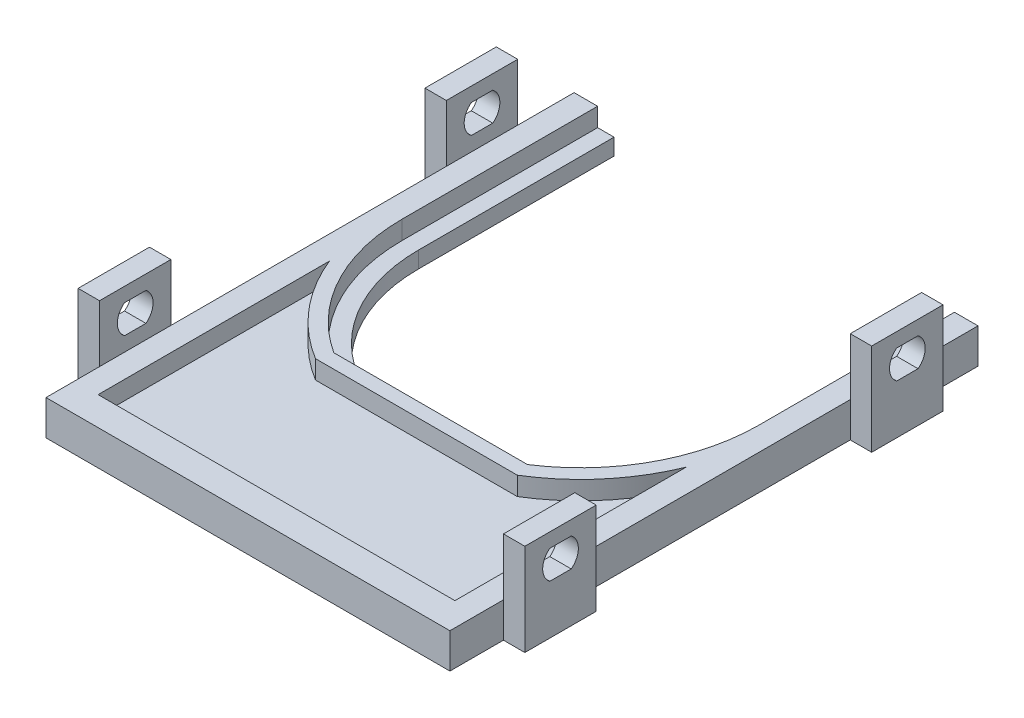
from build123d import *

# Parameters (mm, degrees)
STOCK_BATTERY_START                           = -4.6
STOCK_BATTERY_AND_MICRO_COMPARTMENT_1_DEPTH   = 4.6
STOCK_BATTERY_AND_MICRO_COMPARTMENT_1_2_DEPTH = 2.3
BOSS_EXTRUDE1_START                           = -4.6
BOSS_EXTRUDE1_DEPTH                           = 4.6
CUT_EXTRUDE1_DEPTH                            = 2.3
BOSS_EXTRUDE2_DEPTH                           = 0.3
SKETCH4_W                                     = 74
SKETCH4_H                                     = 4.9
BOSS_EXTRUDE3_DEPTH                           = 0.3
BOSS_EXTRUDE4_START                           = -56.3
SKETCH4_2_W                                   = 74
SKETCH4_2_H                                   = 4.9
BOSS_EXTRUDE4_DEPTH                           = 0.3
SKETCH5_W                                     = 10
SKETCH5_H                                     = 12.9
BOSS_EXTRUDE5_DEPTH                           = 3
BOSS_EXTRUDE7_START                           = -56.6
SKETCH5_2_W                                   = 10
SKETCH5_2_H                                   = 12.9
BOSS_EXTRUDE7_DEPTH                           = 3
CUT_EXTRUDE2_DEPTH                            = 81
CUT_EXTRUDE2_DEPTH_BACK                       = 10
CUT_EXTRUDE3_DEPTH                            = 128
CUT_EXTRUDE3_DEPTH_BACK                       = 10
BOSS_EXTRUDE8_REACH                           = 51.27
BOSS_EXTRUDE8_DIRECTION_2_DEPTH               = 0.03
BOSS_EXTRUDE9_DEPTH                           = 2
SPLIT1_START                                  = 0.33
SPLIT1_DEPTH                                  = 2
SPLIT1_START_2                                = -2.3
SPLIT1_2_DEPTH                                = 2.63


# Read off the part's stored shape, not the designer's step: Stock-Battery and Micro compartment-1, Split1
with BuildPart() as part:
    # Stock-Battery and Micro compartment-1 ou → Stock-Battery and Micro compartment-1 (new body)
    with BuildSketch(Plane(origin=(0, 0, 0), x_dir=(1, 0, 0), z_dir=(0, 1, 0)).offset(STOCK_BATTERY_START)):
        with BuildLine():
            Line((-28, 37.2), (-28, -36.8))
            Line((-28, -36.8), (28, -36.8))
            Line((28, -36.8), (28, 37.2))
            Line((28, 37.2), (25, 37.2))
            Line((25, 37.2), (25, 9.8))
            ThreePointArc((25, 9.8), (0, -15.2), (-25, 9.8))
            Line((-25, 9.8), (-25, 37.2))
            Line((-25, 37.2), (-28, 37.2))
        make_face()
    extrude(amount=STOCK_BATTERY_AND_MICRO_COMPARTMENT_1_DEPTH)

    # Stock-Battery and Micro compartment- 2 → Stock-Battery and Micro compartment-1 2 (add)
    with BuildSketch(Plane(origin=(0, 0, 0), x_dir=(1, 0, 0), z_dir=(0, 1, 0)).offset(STOCK_BATTERY_START)):
        with BuildLine():
            Line((-22.7, 37.2), (-25, 37.2))
            Line((-25, 37.2), (-25, 9.8))
            ThreePointArc((-25, 9.8), (0, -15.2), (25, 9.8))
            Line((25, 9.8), (25, 37.2))
            Line((25, 37.2), (22.7, 37.2))
            Line((22.7, 37.2), (22.7, 9.8))
            ThreePointArc((22.7, 9.8), (0, -12.9), (-22.7, 9.8))
            Line((-22.7, 9.8), (-22.7, 37.2))
        make_face()
    extrude(amount=STOCK_BATTERY_AND_MICRO_COMPARTMENT_1_2_DEPTH)

    # Sketch2 → Boss-Extrude1 (add)
    with BuildSketch(Plane(origin=(0, 0, 0), x_dir=(1, 0, 0), z_dir=(0, 1, 0)).offset(BOSS_EXTRUDE1_START)):
        with BuildLine():
            Line((0, -11.2), (-13.564659966, -11.2))
            ThreePointArc((-13.564659966, -11.2), (0, -15.2), (13.564659966, -11.2))
            Line((13.564659966, -11.2), (0, -11.2))
        make_face()
    extrude(amount=BOSS_EXTRUDE1_DEPTH)

    # Sketch1 → Cut-Extrude1 (cut)
    with BuildSketch(Plane(origin=(0, 0, 0), x_dir=(1, 0, 0), z_dir=(0, 1, 0))):
        with BuildLine():
            Line((14.142135624, -13.2), (-14.142135624, -13.2))
            ThreePointArc((-14.142135624, -13.2), (-20.591241985, -7.66427077), (-25, -0.398039027))
            Line((-25, -0.398039027), (-25, -32.8))
            Line((-25, -32.8), (25, -32.8))
            Line((25, -32.8), (25, -0.398039027))
            ThreePointArc((25, -0.398039027), (20.591241985, -7.66427077), (14.142135624, -13.2))
        make_face()
    extrude(amount=-CUT_EXTRUDE1_DEPTH, mode=Mode.SUBTRACT)

    # Sketch3 → Boss-Extrude2 (add)
    with BuildSketch(Plane(origin=(0, 0, 0), x_dir=(1, 0, 0), z_dir=(0, 1, 0))):
        with BuildLine():
            Line((-25, 37.2), (-28, 37.2))
            Line((-28, 37.2), (-28, -36.8))
            Line((-28, -36.8), (28, -36.8))
            Line((28, -36.8), (28, 37.2))
            Line((28, 37.2), (25, 37.2))
            Line((25, 37.2), (25, 9.8))
            ThreePointArc((25, 9.8), (21.955824958, -2.155824958), (13.564659966, -11.2))
            Line((13.564659966, -11.2), (-13.564659966, -11.2))
            ThreePointArc((-13.564659966, -11.2), (-21.955824958, -2.155824958), (-25, 9.8))
            Line((-25, 9.8), (-25, 37.2))
        make_face()
        with BuildLine():
            Line((-25, -32.8), (25, -32.8))
            Line((25, -32.8), (25, -0.398039027))
            ThreePointArc((25, -0.398039027), (20.591241985, -7.66427077), (14.142135624, -13.2))
            Line((14.142135624, -13.2), (-14.142135624, -13.2))
            ThreePointArc((-14.142135624, -13.2), (-20.591241985, -7.66427077), (-25, -0.398039027))
            Line((-25, -0.398039027), (-25, -32.8))
        make_face(mode=Mode.SUBTRACT)
    extrude(amount=BOSS_EXTRUDE2_DEPTH)

    # Sketch4 → Boss-Extrude3 (add)
    with BuildSketch(Plane(origin=(28, 0, 0), x_dir=(0, 0, -1), z_dir=(1, 0, 0))):
        with Locations((0.2, -2.15)):
            Rectangle(SKETCH4_W, SKETCH4_H)
    extrude(amount=BOSS_EXTRUDE3_DEPTH)

    # Sketch4<2> → Boss-Extrude4 (add)
    with BuildSketch(Plane(origin=(28, 0, 0), x_dir=(0, 0, -1), z_dir=(1, 0, 0)).offset(BOSS_EXTRUDE4_START)):
        with Locations((0.2, -2.15)):
            Rectangle(SKETCH4_2_W, SKETCH4_2_H)
    extrude(amount=BOSS_EXTRUDE4_DEPTH)

    # Sketch5 → Boss-Extrude5 (add)
    with BuildSketch(Plane(origin=(28.3, 0, 0), x_dir=(0, 0, -1), z_dir=(1, 0, 0))):
        with Locations((-24.3, 1.85)):
            Rectangle(SKETCH5_W, SKETCH5_H)
        with Locations((24.3, 1.85)):
            Rectangle(SKETCH5_W, SKETCH5_H)
    extrude(amount=BOSS_EXTRUDE5_DEPTH)

    # Sketch5<2> → Boss-Extrude7 (add)
    with BuildSketch(Plane(origin=(28.3, 0, 0), x_dir=(0, 0, -1), z_dir=(1, 0, 0)).offset(BOSS_EXTRUDE7_START)):
        with Locations((-24.3, 1.85)):
            Rectangle(SKETCH5_2_W, SKETCH5_2_H)
        with Locations((24.3, 1.85)):
            Rectangle(SKETCH5_2_W, SKETCH5_2_H)
    extrude(amount=-BOSS_EXTRUDE7_DEPTH)

    # Sketch8 → Cut-Extrude2 (cut, two sides: drawn at the far end of the back side and taken through both)
    with BuildSketch(Plane(origin=(-28.3, 0, 0), x_dir=(0, 0, -1), z_dir=(1, 0, 0)).offset(-CUT_EXTRUDE2_DEPTH_BACK)):
        with BuildLine():
            Line((22.8, 2.3), (25.8, 2.3))
            ThreePointArc((25.8, 2.3), (26.8, 4.3), (25.8, 6.3))
            Line((25.8, 6.3), (22.8, 6.3))
            ThreePointArc((22.8, 6.3), (21.8, 4.3), (22.8, 2.3))
        make_face()
    extrude(amount=CUT_EXTRUDE2_DEPTH + CUT_EXTRUDE2_DEPTH_BACK, mode=Mode.SUBTRACT)

    # Sketch9 → Cut-Extrude3 (cut, two sides: drawn at the far end of the back side and taken through both)
    with BuildSketch(Plane(origin=(-28.3, 0, 0), x_dir=(0, 0, -1), z_dir=(1, 0, 0)).offset(-CUT_EXTRUDE3_DEPTH_BACK)):
        with BuildLine():
            Line((-25.8, 2.3), (-22.8, 2.3))
            ThreePointArc((-22.8, 2.3), (-21.8, 4.3), (-22.8, 6.3))
            Line((-22.8, 6.3), (-25.8, 6.3))
            ThreePointArc((-25.8, 6.3), (-26.8, 4.3), (-25.8, 2.3))
        make_face()
    extrude(amount=CUT_EXTRUDE3_DEPTH + CUT_EXTRUDE3_DEPTH_BACK, mode=Mode.SUBTRACT)


with BuildPart() as body_2:

    # Sketch10 → Boss-Extrude8 (new, up to next)
    with BuildSketch(Plane(origin=(0, 0.3, 0), x_dir=(1, 0, 0), z_dir=(0, 1, 0)), mode=Mode.PRIVATE) as boss_extrude8_sk1:
        with BuildLine():
            Line((14.142135624, -13.2), (-14.142135624, -13.2))
            ThreePointArc((-14.142135624, -13.2), (-20.180507814, -8.137310399), (-24.5, -1.546805718))
            Line((-24.5, -1.546805718), (-24.5, -5.716120649))
            ThreePointArc((-24.5, -5.716120649), (-20.163977484, -11.042600894), (-14.696938457, -15.2))
            Line((-14.696938457, -15.2), (14.696938457, -15.2))
            ThreePointArc((14.696938457, -15.2), (20.163977484, -11.042600894), (24.5, -5.716120649))
            Line((24.5, -5.716120649), (24.5, -1.546805718))
            ThreePointArc((24.5, -1.546805718), (20.180507814, -8.137310399), (14.142135624, -13.2))
        make_face()
    boss_extrude8_tool1 = extrude(boss_extrude8_sk1.sketch, amount=-BOSS_EXTRUDE8_REACH, mode=Mode.PRIVATE) - part.part
    add(boss_extrude8_tool1.solids().sort_by_distance((0, 0.3, 13.708666))[0])

    # Sketch10 → Boss-Extrude8 direction 2 (add)
    with BuildSketch(Plane(origin=(0, 0.3, 0), x_dir=(1, 0, 0), z_dir=(0, 1, 0))):
        with BuildLine():
            Line((14.142135624, -13.2), (-14.142135624, -13.2))
            ThreePointArc((-14.142135624, -13.2), (-20.180507814, -8.137310399), (-24.5, -1.546805718))
            Line((-24.5, -1.546805718), (-24.5, -5.716120649))
            ThreePointArc((-24.5, -5.716120649), (-20.163977484, -11.042600894), (-14.696938457, -15.2))
            Line((-14.696938457, -15.2), (14.696938457, -15.2))
            ThreePointArc((14.696938457, -15.2), (20.163977484, -11.042600894), (24.5, -5.716120649))
            Line((24.5, -5.716120649), (24.5, -1.546805718))
            ThreePointArc((24.5, -1.546805718), (20.180507814, -8.137310399), (14.142135624, -13.2))
        make_face()
    extrude(amount=BOSS_EXTRUDE8_DIRECTION_2_DEPTH)

    # Sketch11 → Boss-Extrude9 (add)
    with BuildSketch(Plane(origin=(0, 0.33, 0), x_dir=(1, 0, 0), z_dir=(0, 1, 0))):
        with BuildLine():
            Line((-24.5, 8.453194282), (-24.5, -5.716120649))
            ThreePointArc((-24.5, -5.716120649), (-20.163977484, -11.042600894), (-14.696938457, -15.2))
            Line((-14.696938457, -15.2), (14.696938457, -15.2))
            ThreePointArc((14.696938457, -15.2), (20.163977484, -11.042600894), (24.5, -5.716120649))
            Line((24.5, -5.716120649), (24.5, -1.546805718))
            Line((24.5, -1.546805718), (24.5, 8.453194282))
            Line((24.5, 8.453194282), (-24.5, 8.453194282))
        make_face()
    extrude(amount=BOSS_EXTRUDE9_DEPTH)

    # Split1 outline → Split1 (cut)
    with BuildSketch(Plane(origin=(0, 0, 0), x_dir=(1, 0, 0), z_dir=(0, 1, 0)).offset(SPLIT1_START)):
        with BuildLine():
            Line((24.5, -5.716120649), (24.5, 8.453194282))
            Line((24.5, 8.453194282), (-24.5, 8.453194282))
            Line((-24.5, 8.453194282), (-24.5, -5.716120649))
            ThreePointArc((-24.5, -5.716120649), (-20.163977484, -11.042600894), (-14.696938457, -15.2))
            Line((-14.696938457, -15.2), (14.696938457, -15.2))
            ThreePointArc((14.696938457, -15.2), (20.163977484, -11.042600894), (24.5, -5.716120649))
        make_face()
    extrude(amount=SPLIT1_DEPTH, mode=Mode.SUBTRACT)

    # Split1 2 outline → Split1 2 (cut)
    with BuildSketch(Plane(origin=(0, 0, 0), x_dir=(1, 0, 0), z_dir=(0, 1, 0)).offset(SPLIT1_START_2)):
        with BuildLine():
            Line((24.5, -5.716120649), (24.5, -1.546805718))
            ThreePointArc((24.5, -1.546805718), (20.180507814, -8.137310399), (14.142135624, -13.2))
            Line((14.142135624, -13.2), (-14.142135624, -13.2))
            ThreePointArc((-14.142135624, -13.2), (-20.180507814, -8.137310399), (-24.5, -1.546805718))
            Line((-24.5, -1.546805718), (-24.5, -5.716120649))
            ThreePointArc((-24.5, -5.716120649), (-20.163977484, -11.042600894), (-14.696938457, -15.2))
            Line((-14.696938457, -15.2), (14.696938457, -15.2))
            ThreePointArc((14.696938457, -15.2), (20.163977484, -11.042600894), (24.5, -5.716120649))
        make_face()
    extrude(amount=SPLIT1_2_DEPTH, mode=Mode.SUBTRACT)


solid = part.part
